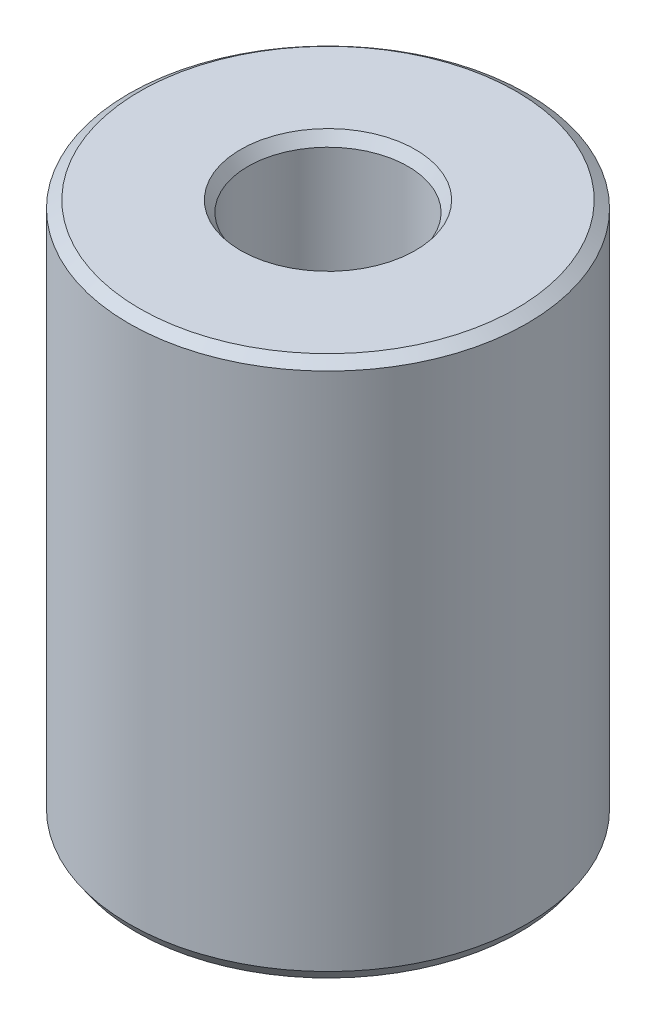
from build123d import *
from OCP.BRepFilletAPI import BRepFilletAPI_MakeChamfer

# Parameters (mm, degrees)
SKETCH1_R           = 25
BOSS_EXTRUDE1_DEPTH = 67.592824548
SKETCH2_R           = 10.046606905
CUT_EXTRUDE1_DEPTH  = 77.280993245
CHAMFER1_SIZE       = 0.934090543
CHAMFER1_SIZE2      = 1.363968934


with BuildPart() as part:
    # Sketch1 → Boss-Extrude1 (new body)
    with BuildSketch(Plane(origin=(0, 0, 0), x_dir=(1, 0, 0), z_dir=(0, 1, 0))):
        Circle(SKETCH1_R)
    extrude(amount=BOSS_EXTRUDE1_DEPTH)

    # Sketch2 → Cut-Extrude1 (cut, through all)
    with BuildSketch(Plane(origin=(0, 0, 0), x_dir=(1, 0, 0), z_dir=(0, 1, 0))):
        Circle(SKETCH2_R)
    extrude(amount=CUT_EXTRUDE1_DEPTH, mode=Mode.SUBTRACT)

    # Chamfer1: one chamfer whose edges measure the first distance from different faces: ONE call of the kernel's chamfer builder (chamfer() names one face for all edges)
    chamfer1_edges_1 = [part.edges().sort_by_distance(p)[0] for p in [
        (-10.046606905, 67.592824548, 0),
    ]]
    chamfer1_side_1 = [part.faces().sort_by_distance(p)[0] for p in [
        (-24.292893219, 67.592824548, 0),
    ]]
    chamfer1_edges_2 = [part.edges().sort_by_distance(p)[0] for p in [
        (-10.046606905, 0, 0),
    ]]
    chamfer1_side_2 = [part.faces().sort_by_distance(p)[0] for p in [
        (-10.046606905, 33.796412274, 0),
    ]]
    chamfer1_edges_3 = [part.edges().sort_by_distance(p)[0] for p in [
        (-25, 0, 0),
    ]]
    chamfer1_side_3 = [part.faces().sort_by_distance(p)[0] for p in [
        (-24.292893219, 0, 0),
    ]]
    chamfer1_edges_4 = [part.edges().sort_by_distance(p)[0] for p in [
        (-25, 67.592824548, 0),
    ]]
    chamfer1_side_4 = [part.faces().sort_by_distance(p)[0] for p in [
        (-25, 33.796412274, 0),
    ]]
    chamfer1 = BRepFilletAPI_MakeChamfer(part.part.solid().wrapped)
    for e in chamfer1_edges_1:
        chamfer1.Add(CHAMFER1_SIZE, CHAMFER1_SIZE2, e.wrapped, chamfer1_side_1[0].wrapped)  # the first distance lies on this face
    for e in chamfer1_edges_2:
        chamfer1.Add(CHAMFER1_SIZE, CHAMFER1_SIZE2, e.wrapped, chamfer1_side_2[0].wrapped)  # the first distance lies on this face
    for e in chamfer1_edges_3:
        chamfer1.Add(CHAMFER1_SIZE, CHAMFER1_SIZE2, e.wrapped, chamfer1_side_3[0].wrapped)  # the first distance lies on this face
    for e in chamfer1_edges_4:
        chamfer1.Add(CHAMFER1_SIZE, CHAMFER1_SIZE2, e.wrapped, chamfer1_side_4[0].wrapped)  # the first distance lies on this face
    add(Compound.cast(chamfer1.Shape()), mode=Mode.REPLACE)


solid = part.part
